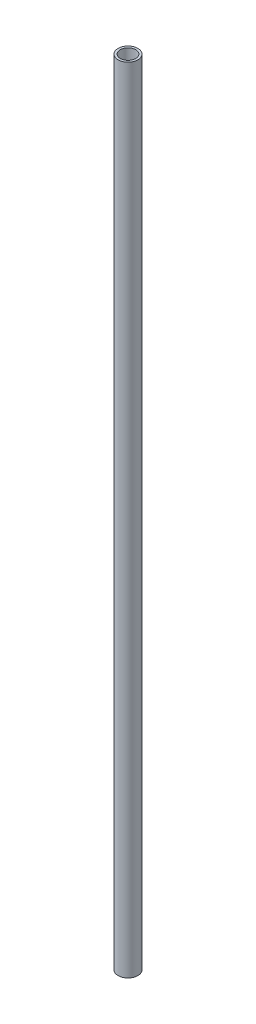
from build123d import *

# Parameters (mm, degrees)
SKETCH1_R           = 1.5875
BOSS_EXTRUDE1_DEPTH = 127
SKETCH2_R           = 1.2319
CUT_EXTRUDE1_DEPTH  = 128.0198422


with BuildPart() as part:
    # Sketch1 → Boss-Extrude1 (new body)
    with BuildSketch(Plane(origin=(0, 0, 0), x_dir=(1, 0, 0), z_dir=(0, 1, 0))):
        Circle(SKETCH1_R)
    extrude(amount=BOSS_EXTRUDE1_DEPTH)

    # Sketch2 → Cut-Extrude1 (cut, through all)
    with BuildSketch(Plane(origin=(0, 127, 0), x_dir=(1, 0, 0), z_dir=(0, 1, 0))):
        Circle(SKETCH2_R)
    extrude(amount=-CUT_EXTRUDE1_DEPTH, mode=Mode.SUBTRACT)


solid = part.part
